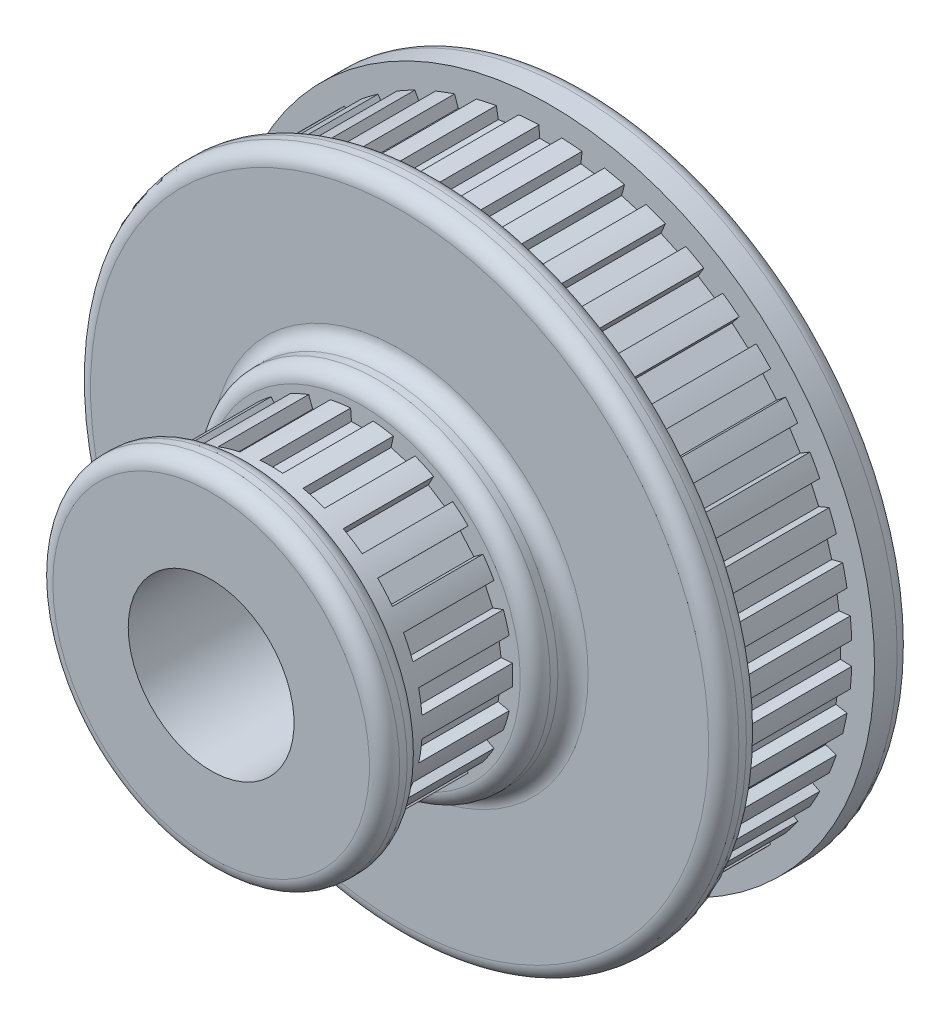
from build123d import *

# Parameters (mm, degrees)
FILLET1_R           = 2
SKETCH3_OUTSIDE_W   = 61.938
SKETCH3_OUTSIDE_H   = 61.938
SKETCH3_OUTSIDE_R   = 21
CUT_EXTRUDE2_DEPTH  = 12
CIRPATTERN1_COUNT   = 22
BOSS_EXTRUDE1_REACH = 43.024
SKETCH4_R           = 15
SKETCH4_R_2         = 11
CUT_EXTRUDE3_REACH  = 43.024
SKETCH4_2_R         = 11
BOSS_EXTRUDE2_START = -30
SKETCH5_R           = 43
SKETCH5_R_2         = 11
BOSS_EXTRUDE2_DEPTH = 30
CUT_EXTRUDE4_START  = -10
SKETCH6_OUTSIDE_W   = 114.3
SKETCH6_OUTSIDE_H   = 114.3
SKETCH6_OUTSIDE_R   = 40
CUT_EXTRUDE4_DEPTH  = 15
CUT_EXTRUDE5_START  = -5
SKETCH7_R           = 43
SKETCH7_R_2         = 23
CUT_EXTRUDE5_DEPTH  = 5
SKETCH8_R           = 35.5
SKETCH8_R_2         = 21
CUT_EXTRUDE6_DEPTH  = 10
CUT_EXTRUDE6_DRAFT  = -30
FILLET2_R           = 2
SKETCH9_OUTSIDE_W   = 114.3
SKETCH9_OUTSIDE_H   = 114.3
SKETCH9_OUTSIDE_R   = 41
CUT_EXTRUDE10_DEPTH = 15
CIRPATTERN2_COUNT   = 44


with BuildPart() as part:
    # Sketch1 → Revolve1 (revolve)
    with BuildSketch(Plane(origin=(0, 0, 0), x_dir=(1, 0, 0), z_dir=(0, 1, 0)), mode=Mode.PRIVATE) as revolve1_sk:
        Polygon((0, 10), (0, 0), (15, 0), (15, -8), (23, -8), (23, -3), (20, -3), (20, 12), (23, 12), (23, 17), (15, 17), (15, 10), align=None)
    revolve(revolve1_sk.sketch.rotate(Axis((0, 0, -10), (0, 0, 1)), 180), axis=Axis((0, 0, -10), (0, 0, 1)))

    # Fillet1
    fillet1_edges = [part.edges().sort_by_distance(p)[0] for p in [
        (23, 0, 8),
        (23, 0, 3),
        (23, 0, -12),
        (23, 0, -17),
    ]]
    fillet(fillet1_edges, radius=FILLET1_R)

    # Sketch3 outside → Cut-Extrude2 (cut)
    # profile 1 of 2: a face of its own
    with BuildSketch(Plane.XY):
        Rectangle(SKETCH3_OUTSIDE_W, SKETCH3_OUTSIDE_H)
        Circle(SKETCH3_OUTSIDE_R, mode=Mode.SUBTRACT)
    # profile 2 of 2: a face of its own
    with BuildSketch(Plane.XY):
        with BuildLine():
            Line((-1.3875, 18.447895375), (1.3875, 18.447895375))
            Line((1.3875, 18.447895375), (1.5, 19.943670675))
            ThreePointArc((1.5, 19.943670675), (0, 20), (-1.5, 19.943670675))
            Line((-1.5, 19.943670675), (-1.3875, 18.447895375))
        make_face()
    cut_extrude2 = extrude(amount=-CUT_EXTRUDE2_DEPTH, mode=Mode.SUBTRACT)

    # CirPattern1: Cut-Extrude2 ×22 about axis
    cirpattern1_axis = Axis((0, 0, 0), (0, 0, 1))
    for i in range(1, CIRPATTERN1_COUNT):
        add(cut_extrude2.rotate(cirpattern1_axis, i * 360 / CIRPATTERN1_COUNT), mode=Mode.SUBTRACT)

    # Boss-Extrude1: up to this face of the body (flat: up to its plane)
    boss_extrude1_end = Plane(part.part.faces().sort_by_distance((20.406030304, 0, 8))[0])
    # Sketch4 → Boss-Extrude1 (add, up to the picked face)
    with BuildSketch(Plane(origin=(0, 0, -17), x_dir=(-1, 0, 0), z_dir=(0, 0, -1)), mode=Mode.PRIVATE) as boss_extrude1_sk1:
        Circle(SKETCH4_R)
        Circle(SKETCH4_R_2, mode=Mode.SUBTRACT)
    boss_extrude1_tool1 = split(extrude(boss_extrude1_sk1.sketch, amount=-BOSS_EXTRUDE1_REACH, mode=Mode.PRIVATE), bisect_by=boss_extrude1_end, keep=Keep.BOTH, mode=Mode.PRIVATE)
    add(boss_extrude1_tool1.solids().sort_by(Axis((14.575736, 0, -17), (0, 0, 1)))[0])

    # Sketch4<2> → Cut-Extrude3 (cut, up to next)
    with BuildSketch(Plane(origin=(0, 0, -17), x_dir=(-1, 0, 0), z_dir=(0, 0, -1)), mode=Mode.PRIVATE) as cut_extrude3_sk1:
        Circle(SKETCH4_2_R)
    cut_extrude3_tool1 = extrude(cut_extrude3_sk1.sketch, amount=-CUT_EXTRUDE3_REACH, mode=Mode.PRIVATE) & part.part
    add(cut_extrude3_tool1.solids().sort_by_distance((0, 0, -17))[0], mode=Mode.SUBTRACT)

    # Sketch5 → Boss-Extrude2 (add)
    with BuildSketch(Plane.XY.offset(-12).offset(BOSS_EXTRUDE2_START)):
        Circle(SKETCH5_R)
        with Locations(Location((0, 0, 0), (0, 0, 180))):
            Circle(SKETCH5_R_2, mode=Mode.SUBTRACT)
    extrude(amount=BOSS_EXTRUDE2_DEPTH)

    # Sketch6 outside → Cut-Extrude4 (cut)
    with BuildSketch(Plane.XY.offset(-12).offset(CUT_EXTRUDE4_START)):
        Rectangle(SKETCH6_OUTSIDE_W, SKETCH6_OUTSIDE_H)
        Circle(SKETCH6_OUTSIDE_R, mode=Mode.SUBTRACT)
    extrude(amount=-CUT_EXTRUDE4_DEPTH, mode=Mode.SUBTRACT)

    # Sketch7 → Cut-Extrude5 (cut)
    with BuildSketch(Plane.XY.offset(-12).offset(CUT_EXTRUDE5_START)):
        Circle(SKETCH7_R)
        with Locations(Location((0, 0, 0), (0, 0, 180))):
            Circle(SKETCH7_R_2, mode=Mode.SUBTRACT)
    extrude(amount=CUT_EXTRUDE5_DEPTH, mode=Mode.SUBTRACT)


with BuildPart() as cut_extrude6_tool:
    # Sketch8 → Cut-Extrude6 (with draft: the straight prism first)
    with BuildSketch(Plane(origin=(0, 0, -42), x_dir=(-1, 0, 0), z_dir=(0, 0, -1))):
        Circle(SKETCH8_R)
        Circle(SKETCH8_R_2, mode=Mode.SUBTRACT)
    extrude(amount=-CUT_EXTRUDE6_DEPTH)
    # Cut-Extrude6: the draft: its side faces are tilted about the plane it starts from
    cut_extrude6_sides = [cut_extrude6_tool.faces().sort_by_distance(p)[0] for p in [
        (35.5, 0, -37),
        (21, 0, -37),
    ]]
    draft(cut_extrude6_sides, Plane(origin=(0, 0, -42), x_dir=(-1, 0, 0), z_dir=(0, 0, -1)), CUT_EXTRUDE6_DRAFT)


with BuildPart() as part_1:
    add(part.part)

    # Cut-Extrude6: cut by cut_extrude6_tool
    add(cut_extrude6_tool.part, mode=Mode.SUBTRACT)

    # Fillet2
    fillet2_edges = [part_1.edges().sort_by_distance(p)[0] for p in [
        (-43, 0, -42),
        (-43, 0, -22),
        (-43, 0, -17),
        (23, 0, -17),
        (23, 0, -12),
        (29.726497308, 0, -32),
        (26.773502692, 0, -32),
        (35.5, 0, -42),
        (21, 0, -42),
    ]]
    fillet(fillet2_edges, radius=FILLET2_R - 0.0001)  # a hair under: the kernel refuses the full size

    # Sketch9 outside → Cut-Extrude10 (cut)
    # profile 1 of 2: a face of its own
    with BuildSketch(Plane.XY.offset(-37)):
        Rectangle(SKETCH9_OUTSIDE_W, SKETCH9_OUTSIDE_H)
        Circle(SKETCH9_OUTSIDE_R, mode=Mode.SUBTRACT)
    # profile 2 of 2: a face of its own
    with BuildSketch(Plane.XY.offset(-37)):
        with BuildLine():
            Line((-1.44375, 38.472920164), (1.44375, 38.472920164))
            Line((1.44375, 38.472920164), (1.5, 39.971865105))
            ThreePointArc((1.5, 39.971865105), (0, 40), (-1.5, 39.971865105))
            Line((-1.5, 39.971865105), (-1.44375, 38.472920164))
        make_face()
    cut_extrude10 = extrude(amount=CUT_EXTRUDE10_DEPTH, mode=Mode.SUBTRACT)

    # CirPattern2: Cut-Extrude10 ×44 about axis
    cirpattern2_axis = Axis((0, 0, 0), (0, 0, 1))
    for i in range(1, CIRPATTERN2_COUNT):
        add(cut_extrude10.rotate(cirpattern2_axis, i * 360 / CIRPATTERN2_COUNT), mode=Mode.SUBTRACT)


solid = part_1.part
